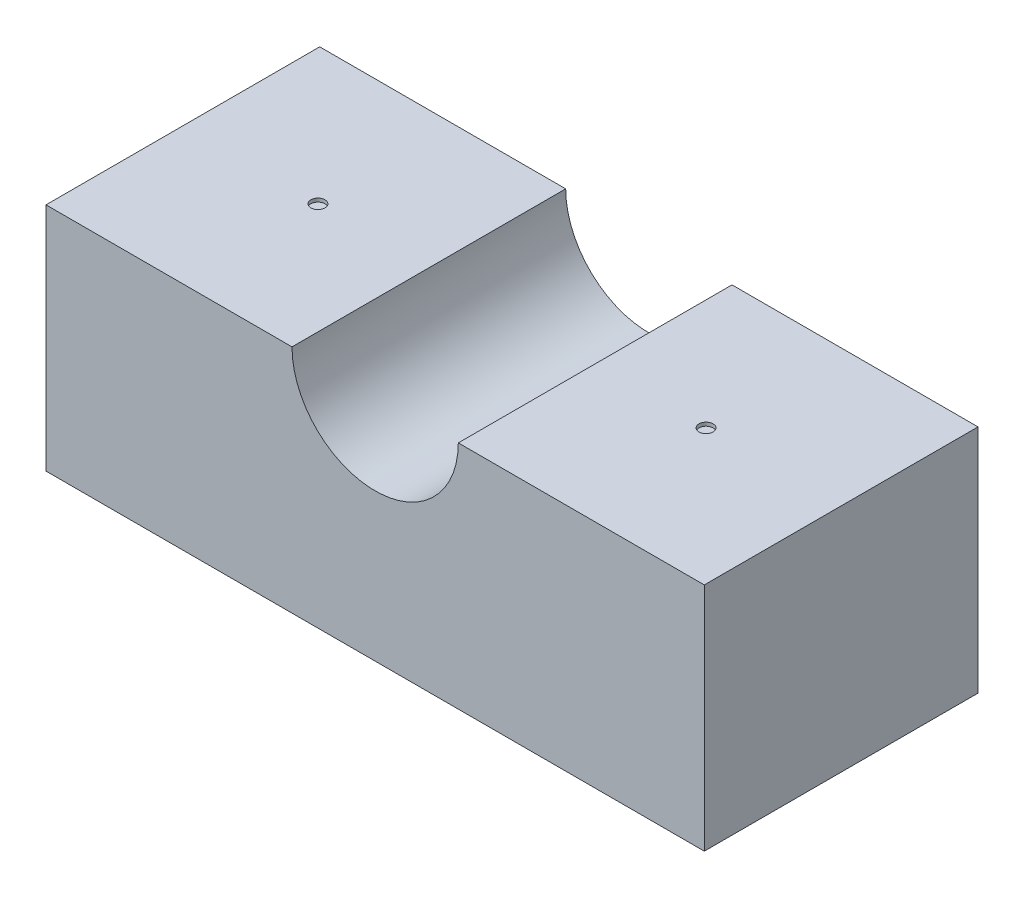
from build123d import *

# Parameters (mm, degrees)
SKETCH2_W           = 23.74600026
SKETCH2_H           = 9.873000066
BOSS_EXTRUDE1_DEPTH = 8.3185
SKETCH3_R           = 2.99974
CUT_EXTRUDE1_DEPTH  = 18.539717918
SKETCH4_R           = 0.254
CUT_EXTRUDE2_DEPTH  = 0.127


with BuildPart() as part:
    # Sketch2 → Boss-Extrude1 (new body)
    with BuildSketch(Plane(origin=(0, 0, 0), x_dir=(1, 0, 0), z_dir=(0, 1, 0))):
        Rectangle(SKETCH2_W, SKETCH2_H)
    extrude(amount=BOSS_EXTRUDE1_DEPTH)

    # Sketch3 → Cut-Extrude1 (cut, through all)
    with BuildSketch(Plane.XY.offset(4.936500033)):
        with Locations((0, 8.3185)):
            Circle(SKETCH3_R)
    extrude(amount=-CUT_EXTRUDE1_DEPTH, mode=Mode.SUBTRACT)

    # Sketch4 → Cut-Extrude2 (cut)
    with BuildSketch(Plane(origin=(0, 8.3185, 0), x_dir=(1, 0, 0), z_dir=(0, 1, 0))):
        with Locations((-6.99999997, 0)):
            Circle(SKETCH4_R)
        with Locations((6.99999997, 0)):
            Circle(SKETCH4_R)
    extrude(amount=-CUT_EXTRUDE2_DEPTH, mode=Mode.SUBTRACT)


solid = part.part
